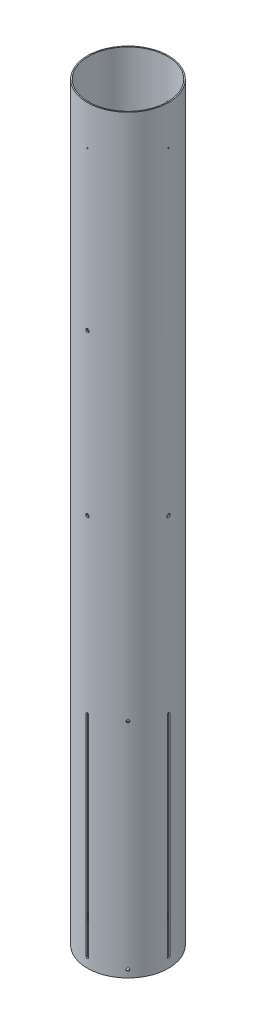
from build123d import *

# Parameters (mm, degrees)
SUSTAINER_TUBE_PROFILE_R       = 78.359
SUSTAINER_TUBE_PROFILE_R_2     = 76.2
SUSTAINER_TUBE_BODY_DEPTH      = 1447.8
FIN_SLOT_CUT_REACH             = 1460.364
FIN_SLOT_CUT_END_RADIUS        = 76.2
FIN_SLOT_PATTERN_COUNT         = 4
SKETCH1_R                      = 1.143
CUT_EXTRUDE1_DEPTH             = 1453.034815727
CIRPATTERN1_COUNT              = 4
CUT_EXTRUDE2_DEPTH             = 1453.034815727
CUT_EXTRUDE2_DEPTH_BACK        = 1453.034815727
SKETCH2_R                      = 3.175
SKETCH3_R                      = 3.175
CUT_EXTRUDE3_DEPTH             = 1453.034815727
CIRPATTERN2_COUNT              = 4
CUT_EXTRUDE4_REACH             = 1462.107
CUT_EXTRUDE4_END_RADIUS        = 76.2
SKETCH4_R                      = 2.57937
CUT_EXTRUDE4_DIRECTION_2_DEPTH = 1461.106899298


with BuildPart() as part:
    # Sustainer Tube Profile → Sustainer Tube Body (new body)
    with BuildSketch(Plane(origin=(0, 0, 0), x_dir=(1, 0, 0), z_dir=(0, 1, 0))):
        Circle(SUSTAINER_TUBE_PROFILE_R)
        Circle(SUSTAINER_TUBE_PROFILE_R_2, mode=Mode.SUBTRACT)
    extrude(amount=SUSTAINER_TUBE_BODY_DEPTH)

    # Fin Slot Cut: up to this cylinder (the profile starts outside it)
    fin_slot_cut_end = Plane(origin=(0, 222.25, 0), z_dir=(0, -1, 0)) * Cylinder(FIN_SLOT_CUT_END_RADIUS, 3074.128, mode=Mode.PRIVATE)
    # Fin Slot Profile → Fin Slot Cut (cut, up to the surface)
    with BuildSketch(Plane.XY.offset(78.359), mode=Mode.PRIVATE) as fin_slot_cut_sk1:
        with BuildLine():
            Line((-2.38125, 425.45), (-2.38125, 19.05))
            ThreePointArc((-2.38125, 19.05), (0, 16.66875), (2.38125, 19.05))
            Line((2.38125, 19.05), (2.38125, 425.45))
            ThreePointArc((2.38125, 425.45), (0, 427.83125), (-2.38125, 425.45))
        make_face()
    fin_slot_cut_tool1 = extrude(fin_slot_cut_sk1.sketch, amount=-FIN_SLOT_CUT_REACH, mode=Mode.PRIVATE) - fin_slot_cut_end
    fin_slot_cut = fin_slot_cut_tool1.solids().sort_by_distance((0, 222.25, 78.359))[0]
    add(fin_slot_cut, mode=Mode.SUBTRACT)

    # Fin Slot Pattern: Fin Slot Cut ×4 about axis
    fin_slot_pattern_axis = Axis((0, 1447.8, 0), (0, 1, 0))
    for i in range(1, FIN_SLOT_PATTERN_COUNT):
        add(fin_slot_cut.rotate(fin_slot_pattern_axis, i * 360 / FIN_SLOT_PATTERN_COUNT), mode=Mode.SUBTRACT)

    # Sketch1 → Cut-Extrude1 (cut, symmetric)
    with BuildSketch(Plane.XY):
        with Locations((0, 1371.6)):
            Circle(SKETCH1_R)
    cut_extrude1 = extrude(amount=CUT_EXTRUDE1_DEPTH, both=True, mode=Mode.SUBTRACT)

    # CirPattern1: Cut-Extrude1 ×4 about axis
    cirpattern1_axis = Axis((0, 1447.8, 0), (0, 1, 0))
    for i in range(1, CIRPATTERN1_COUNT):
        add(cut_extrude1.rotate(cirpattern1_axis, i * 360 / CIRPATTERN1_COUNT), mode=Mode.SUBTRACT)

    # Sketch2 → Cut-Extrude2 (cut, two sides: drawn at the far end of the back side and taken through both)
    with BuildSketch(Plane.XY.offset(-CUT_EXTRUDE2_DEPTH_BACK)):
        with Locations((0, 1066.8)):
            Circle(SKETCH2_R)
    extrude(amount=CUT_EXTRUDE2_DEPTH + CUT_EXTRUDE2_DEPTH_BACK, mode=Mode.SUBTRACT)

    # Sketch3 → Cut-Extrude3 (cut, symmetric)
    with BuildSketch(Plane.XY):
        with Locations((0, 756.9962)):
            Circle(SKETCH3_R)
    cut_extrude3 = extrude(amount=CUT_EXTRUDE3_DEPTH, both=True, mode=Mode.SUBTRACT)

    # CirPattern2: Cut-Extrude3 ×4 about axis
    cirpattern2_axis = Axis((0, 1447.8, 0), (0, 1, 0))
    for i in range(1, CIRPATTERN2_COUNT):
        add(cut_extrude3.rotate(cirpattern2_axis, i * 360 / CIRPATTERN2_COUNT), mode=Mode.SUBTRACT)

    # Cut-Extrude4: up to this cylinder (the profile starts outside it)
    cut_extrude4_end = Plane(origin=(0, 221.74454, 0), z_dir=(0, -1, 0)) * Cylinder(CUT_EXTRUDE4_END_RADIUS, 3493.01068, mode=Mode.PRIVATE)
    # Sketch4 → Cut-Extrude4 (cut, up to the surface)
    with BuildSketch(Plane(origin=(55.408180267, 0, 55.408180267), x_dir=(0, -1, 0), z_dir=(0.7071067811865488, 0, 0.7071067811865464)), mode=Mode.PRIVATE) as cut_extrude4_sk1:
        with Locations((-14.0462, 0)):
            Circle(SKETCH4_R)
    cut_extrude4_tool1 = extrude(cut_extrude4_sk1.sketch, amount=-CUT_EXTRUDE4_REACH, mode=Mode.PRIVATE) - cut_extrude4_end
    add(cut_extrude4_tool1.solids().sort_by_distance((55.40818, 14.0462, 55.40818))[0], mode=Mode.SUBTRACT)
    # Sketch4 → Cut-Extrude4 (cut, up to the surface)
    with BuildSketch(Plane(origin=(55.408180267, 0, 55.408180267), x_dir=(0, -1, 0), z_dir=(0.7071067811865488, 0, 0.7071067811865464)), mode=Mode.PRIVATE) as cut_extrude4_sk2:
        with Locations((-429.44288, 0)):
            Circle(SKETCH4_R)
    cut_extrude4_tool2 = extrude(cut_extrude4_sk2.sketch, amount=-CUT_EXTRUDE4_REACH, mode=Mode.PRIVATE) - cut_extrude4_end
    add(cut_extrude4_tool2.solids().sort_by_distance((55.40818, 429.44288, 55.40818))[0], mode=Mode.SUBTRACT)

    # Sketch4 → Cut-Extrude4 direction 2 (cut)
    with BuildSketch(Plane(origin=(55.408180267, 0, 55.408180267), x_dir=(0, -1, 0), z_dir=(0.7071067811865488, 0, 0.7071067811865464))):
        with Locations((-14.0462, 0)):
            Circle(SKETCH4_R)
        with Locations((-429.44288, 0)):
            Circle(SKETCH4_R)
    extrude(amount=CUT_EXTRUDE4_DIRECTION_2_DEPTH, mode=Mode.SUBTRACT)


solid = part.part
